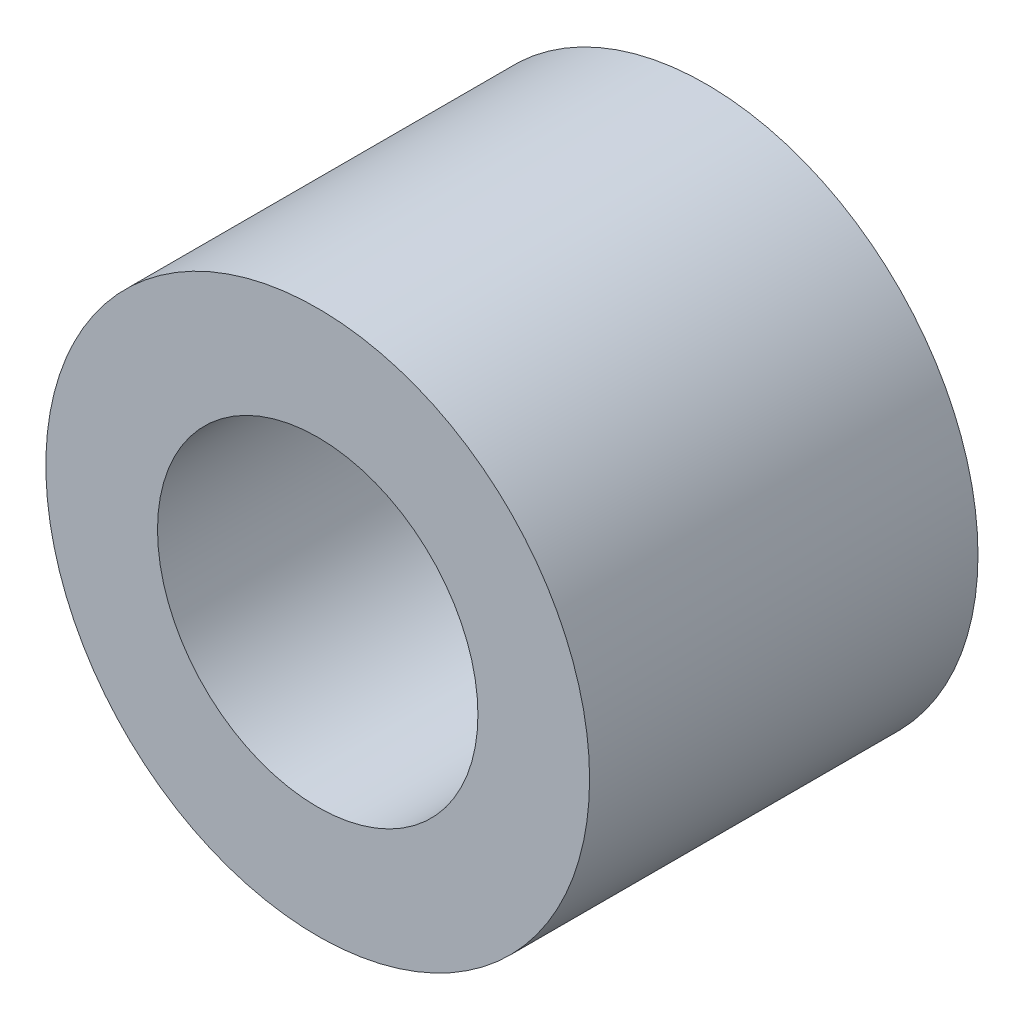
from build123d import *

# Parameters (mm, degrees)
SKETCH_1_R      = 2.8
SKETCH_1_R_2    = 1.65
EXTRUDE_1_DEPTH = 4


with BuildPart() as part:
    # 草图1 → 凸台-拉伸1 (new body)
    with BuildSketch(Plane.XY):
        Circle(SKETCH_1_R)
        Circle(SKETCH_1_R_2, mode=Mode.SUBTRACT)
    extrude(amount=EXTRUDE_1_DEPTH)


solid = part.part
